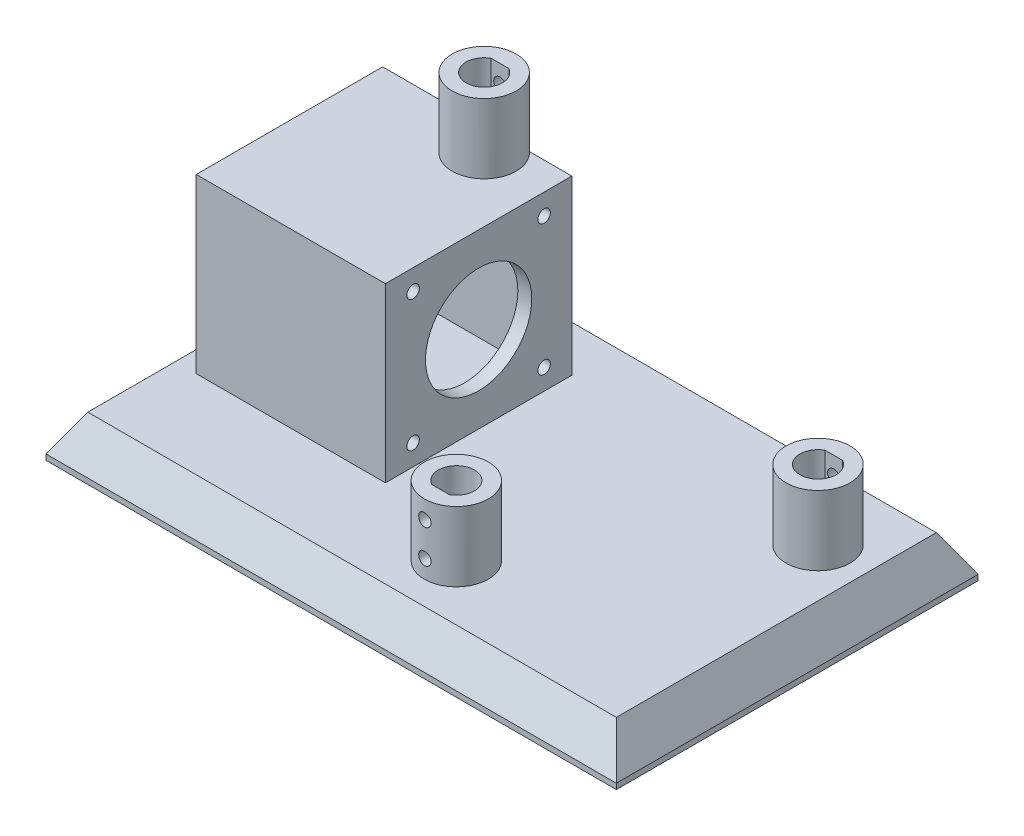
from build123d import *
from OCP.BRepFilletAPI import BRepFilletAPI_MakeChamfer

# Parameters (mm, degrees)
SKETCH1_W                      = 205
SKETCH1_H                      = 130
BOSS_EXTRUDE1_DEPTH            = 7.5
CHAMFER1_SIZE                  = 13
CHAMFER1_SIZE2                 = 7.505553499
SKETCH3_W                      = 68
SKETCH3_H                      = 67
BOSS_EXTRUDE2_DEPTH            = 62
CUT_EXTRUDE4_DEPTH             = 10
CUT_EXTRUDE4_DEPTH_BACK        = 63
SKETCH8_W                      = 57
SKETCH8_H                      = 57
SKETCH5_R                      = 11.5
SHAFT_1_DEPTH                  = 25
F_4_5_4_5_DIAMETER_HOLE1_D     = 4.5
F_4_5_4_5_DIAMETER_HOLE1_DEPTH = 5.829194732
SKETCH9_R                      = 11.5
SHAFT_2_DEPTH                  = 25
SUPPORT_START                  = 7.5
SUPPORT_STRUCTURE_DEPTH        = 62
F_4_5_4_5_DIAMETER_HOLE2_D     = 4.5
F_4_5_4_5_DIAMETER_HOLE2_DEPTH = 5.829194732
SKETCH15_R                     = 11.5
SHAFT_3_DEPTH                  = 25
F_4_5_4_5_DIAMETER_HOLE3_D     = 4.5
F_4_5_4_5_DIAMETER_HOLE3_DEPTH = 5.829194732
CUT_EXTRUDE3_REACH             = 169.449
SKETCH18_R                     = 19.1
F_4_5_4_5_DIAMETER_HOLE4_D     = 4.5
CIRPATTERN1_START              = -42
CIRPATTERN1_OUTLINE_R          = 2.25
CIRPATTERN1_DEPTH              = 5
LPATTERN1_COUNT                = 2
LPATTERN1_PITCH                = 12


# Read off the part's stored shape, not the designer's step: Support Structure, CirPattern1
with BuildPart() as part:
    # Sketch1 → Boss-Extrude1 (new, symmetric)
    with BuildSketch(Plane(origin=(0, 0, 0), x_dir=(1, 0, 0), z_dir=(0, 1, 0))):
        with Locations((-17.5, 0)):
            Rectangle(SKETCH1_W, SKETCH1_H)
    extrude(amount=BOSS_EXTRUDE1_DEPTH, both=True)

    # Chamfer1: one chamfer whose edges measure the first distance from different faces: ONE call of the kernel's chamfer builder (chamfer() names one face for all edges)
    chamfer1_edges_1 = [part.edges().sort_by_distance(p)[0] for p in [
        (-120, 7.5, 0),
    ]]
    chamfer1_side_1 = [part.faces().sort_by_distance(p)[0] for p in [
        (-120, 0, 0),
    ]]
    chamfer1_edges_2 = [part.edges().sort_by_distance(p)[0] for p in [
        (-17.5, 7.5, 65),
    ]]
    chamfer1_side_2 = [part.faces().sort_by_distance(p)[0] for p in [
        (-17.5, 0, 65),
    ]]
    chamfer1_edges_3 = [part.edges().sort_by_distance(p)[0] for p in [
        (85, 7.5, 0),
    ]]
    chamfer1_side_3 = [part.faces().sort_by_distance(p)[0] for p in [
        (85, 0, 0),
    ]]
    chamfer1_edges_4 = [part.edges().sort_by_distance(p)[0] for p in [
        (-17.5, 7.5, -65),
    ]]
    chamfer1_side_4 = [part.faces().sort_by_distance(p)[0] for p in [
        (-17.5, 0, -65),
    ]]
    chamfer1 = BRepFilletAPI_MakeChamfer(part.part.solid().wrapped)
    for e in chamfer1_edges_1:
        chamfer1.Add(CHAMFER1_SIZE, CHAMFER1_SIZE2, e.wrapped, chamfer1_side_1[0].wrapped)  # the first distance lies on this face
    for e in chamfer1_edges_2:
        chamfer1.Add(CHAMFER1_SIZE, CHAMFER1_SIZE2, e.wrapped, chamfer1_side_2[0].wrapped)  # the first distance lies on this face
    for e in chamfer1_edges_3:
        chamfer1.Add(CHAMFER1_SIZE, CHAMFER1_SIZE2, e.wrapped, chamfer1_side_3[0].wrapped)  # the first distance lies on this face
    for e in chamfer1_edges_4:
        chamfer1.Add(CHAMFER1_SIZE, CHAMFER1_SIZE2, e.wrapped, chamfer1_side_4[0].wrapped)  # the first distance lies on this face
    add(Compound.cast(chamfer1.Shape()), mode=Mode.REPLACE)

    # Sketch3 → Boss-Extrude2 (add)
    with BuildSketch(Plane(origin=(0, 7.5, 0), x_dir=(1, 0, 0), z_dir=(0, 1, 0))):
        with Locations((-71, 7.5)):
            Rectangle(SKETCH3_W, SKETCH3_H)
    extrude(amount=BOSS_EXTRUDE2_DEPTH)

    # Sketch8 → Cut-Extrude4 (cut, two sides: drawn at the far end of the back side and taken through both)
    with BuildSketch(Plane.ZY.offset(105).offset(-CUT_EXTRUDE4_DEPTH_BACK)):
        with Locations((-7.5, 36)):
            Rectangle(SKETCH8_W, SKETCH8_H)
    extrude(amount=CUT_EXTRUDE4_DEPTH + CUT_EXTRUDE4_DEPTH_BACK, mode=Mode.SUBTRACT)

    # Sketch5 → Shaft 1 (add)
    with BuildSketch(Plane(origin=(0, 7.5, 0), x_dir=(1, 0, 0), z_dir=(0, 1, 0))):
        with Locations(Location((60, 32.5, 0), (0, 0, 90))):
            Circle(SKETCH5_R)
        with BuildLine():
            Line((56.825, 38.171805268), (63.175, 38.171805268))
            ThreePointArc((63.175, 38.171805268), (60, 26), (56.825, 38.171805268))
        make_face(mode=Mode.SUBTRACT)
    extrude(amount=SHAFT_1_DEPTH)

    # Ø4.5 (4.5) Diameter Hole1
    with Locations(Plane.XY.offset(-38.171805268)):
        with Locations((60, 26)):
            f_4_5_4_5_diameter_hole1 = Hole(F_4_5_4_5_DIAMETER_HOLE1_D / 2, depth=F_4_5_4_5_DIAMETER_HOLE1_DEPTH)

    # Sketch9 → Shaft 2 (add)
    with BuildSketch(Plane(origin=(0, 69.5, 0), x_dir=(1, 0, 0), z_dir=(0, 1, 0))):
        with Locations(Location((-60, 32.5, 0), (0, 0, 47.657394548))):
            Circle(SKETCH9_R)
        with BuildLine():
            Line((-63.175, 38.171805268), (-56.825, 38.171805268))
            ThreePointArc((-56.825, 38.171805268), (-60, 26), (-63.175, 38.171805268))
        make_face(mode=Mode.SUBTRACT)
    extrude(amount=SHAFT_2_DEPTH)

    # Support Structure outline → Support Structure (add)
    with BuildSketch(Plane(origin=(0, 0, 0), x_dir=(1, 0, 0), z_dir=(0, 1, 0)).offset(SUPPORT_START)):
        with BuildLine():
            Line((-67.745966692, 41), (-52.254033308, 41))
            ThreePointArc((-52.254033308, 41), (-60, 44), (-67.745966692, 41))
        make_face()
    extrude(amount=SUPPORT_STRUCTURE_DEPTH)

    # Ø4.5 (4.5) Diameter Hole2
    with Locations(Plane.XY.offset(-38.171805268)):
        with Locations((-60, 88)):
            f_4_5_4_5_diameter_hole2 = Hole(F_4_5_4_5_DIAMETER_HOLE2_D / 2, depth=F_4_5_4_5_DIAMETER_HOLE2_DEPTH)

    # Sketch15 → Shaft 3 (add)
    with BuildSketch(Plane(origin=(0, 7.5, 0), x_dir=(1, 0, 0), z_dir=(0, 1, 0))):
        with Locations(Location((0, -37.5, 0), (0, 0, 90))):
            Circle(SKETCH15_R)
        with BuildLine():
            Line((3.175, -43.171805268), (-3.175, -43.171805268))
            ThreePointArc((-3.175, -43.171805268), (0, -31), (3.175, -43.171805268))
        make_face(mode=Mode.SUBTRACT)
    extrude(amount=SHAFT_3_DEPTH)

    # Ø4.5 (4.5) Diameter Hole3
    with Locations(Plane(origin=(0, 0, 43.171805268), x_dir=(-1, 0, 0), z_dir=(0, 0, -1))):
        with Locations((0, 26)):
            f_4_5_4_5_diameter_hole3 = Hole(F_4_5_4_5_DIAMETER_HOLE3_D / 2, depth=F_4_5_4_5_DIAMETER_HOLE3_DEPTH)

    # Sketch18 → Cut-Extrude3 (cut, up to next)
    with BuildSketch(Plane(origin=(-37, 0, 0), x_dir=(0, 0, -1), z_dir=(1, 0, 0)), mode=Mode.PRIVATE) as cut_extrude3_sk1:
        with Locations((7.5, 38.5)):
            Circle(SKETCH18_R)
    cut_extrude3_tool1 = extrude(cut_extrude3_sk1.sketch, amount=-CUT_EXTRUDE3_REACH, mode=Mode.PRIVATE) & part.part
    add(cut_extrude3_tool1.solids().sort_by_distance((-37, 38.5, -7.5))[0], mode=Mode.SUBTRACT)

    # Ø4.5 (4.5) Diameter Hole4 (through all)
    with Locations(Plane(origin=(-37, 0, 0), x_dir=(0, 0, -1), z_dir=(1, 0, 0))):
        with Locations((31.05, 62.05)):
            Hole(F_4_5_4_5_DIAMETER_HOLE4_D / 2)

    # CirPattern1 outline → CirPattern1 (cut)
    with BuildSketch(Plane.YZ.offset(CIRPATTERN1_START)):
        with Locations((62.05, 16.05)):
            Circle(CIRPATTERN1_OUTLINE_R)
        with Locations((14.95, 16.05)):
            Circle(CIRPATTERN1_OUTLINE_R)
        with Locations((14.95, -31.05)):
            Circle(CIRPATTERN1_OUTLINE_R)
    extrude(amount=CIRPATTERN1_DEPTH, mode=Mode.SUBTRACT)

    # LPattern1: Ø4.5 (4.5) Diameter Hole1, Ø4.5 (4.5) Diameter Hole2, Ø4.5 (4.5) Diameter Hole3 ×2
    with Locations(*[(0, -i * LPATTERN1_PITCH, 0) for i in range(1, LPATTERN1_COUNT)]):
        add(f_4_5_4_5_diameter_hole1, mode=Mode.SUBTRACT)
        add(f_4_5_4_5_diameter_hole2, mode=Mode.SUBTRACT)
        add(f_4_5_4_5_diameter_hole3, mode=Mode.SUBTRACT)


solid = part.part
